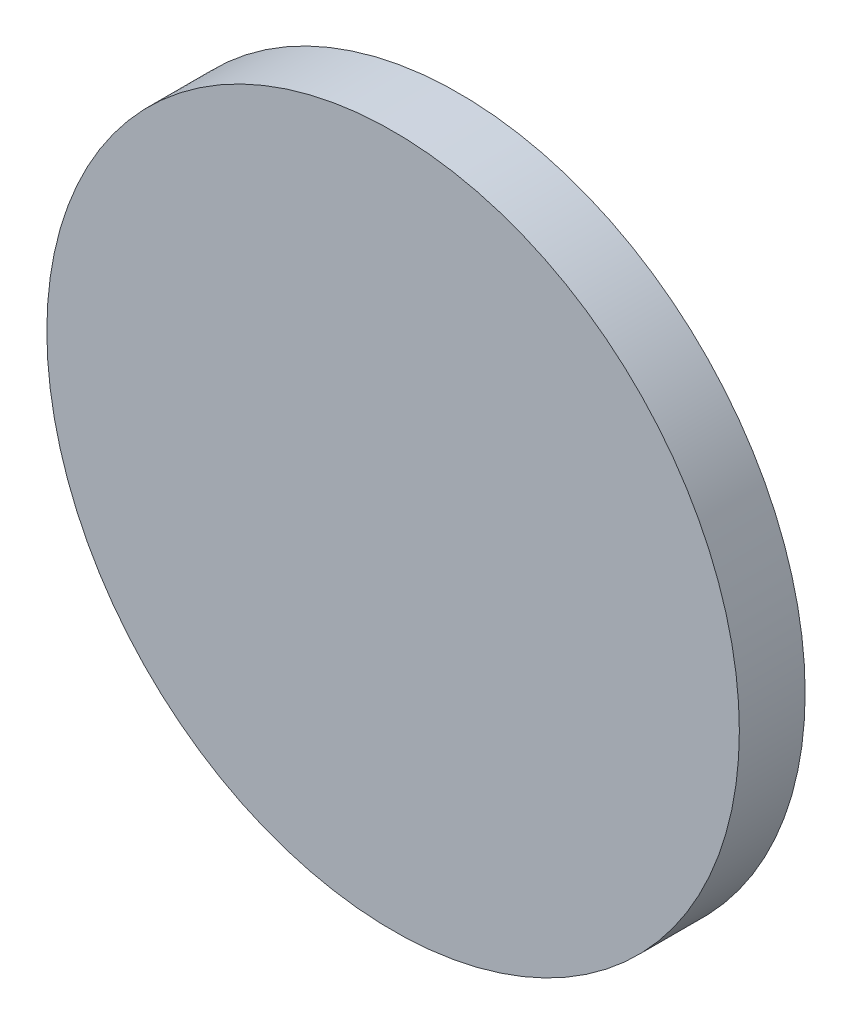
from build123d import *

# Parameters (mm, degrees)
SKETCH1_R           = 21.05
SKETCH1_R_2         = 20.05
BOSS_EXTRUDE1_DEPTH = 3
SKETCH2_R           = 21.05
BOSS_EXTRUDE3_DEPTH = 1
FILLET1_R           = 0.5


with BuildPart() as part:
    # Sketch1 → Boss-Extrude1 (new body)
    with BuildSketch(Plane.XY):
        Circle(SKETCH1_R)
        Circle(SKETCH1_R_2, mode=Mode.SUBTRACT)
    extrude(amount=BOSS_EXTRUDE1_DEPTH)

    # Sketch2 → Boss-Extrude3 (add)
    with BuildSketch(Plane.XY.offset(3)):
        Circle(SKETCH2_R)
    extrude(amount=BOSS_EXTRUDE3_DEPTH)

    # Fillet1
    fillet1_edges = [part.edges().sort_by_distance(p)[0] for p in [
        (-20.05, 0, 0),
    ]]
    fillet(fillet1_edges, radius=FILLET1_R)


solid = part.part
